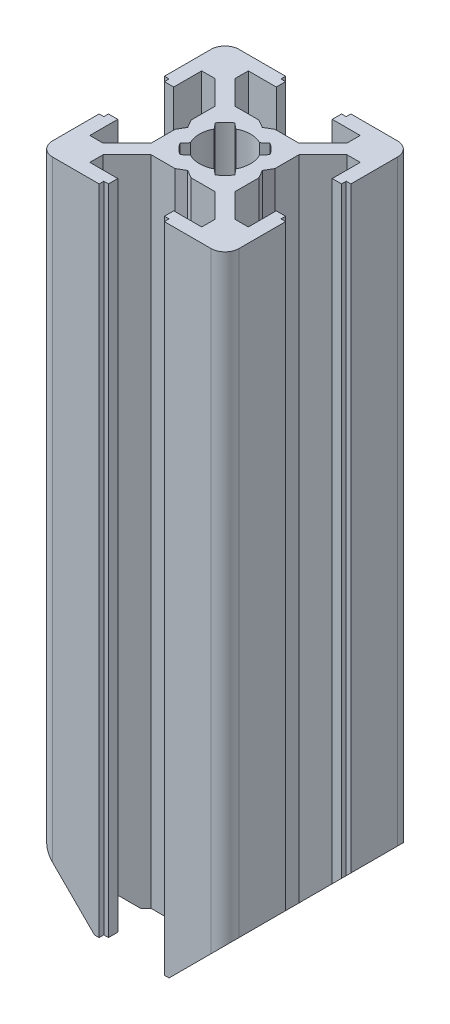
from build123d import *

# Parameters (mm, degrees)
BOSS_EXTRUDE1_DEPTH     = 70
CUT_EXTRUDE1_DEPTH      = 72.414284285
CUT_EXTRUDE1_DEPTH_BACK = 72.414284285
SKETCH3_R               = 2


# Read off the part's stored shape, not the designer's step: Imported1
with BuildPart() as part:
    # Sketch1 → Boss-Extrude1 (new body)
    with BuildSketch(Plane(origin=(0, 0, 0), x_dir=(1, 0, 0), z_dir=(0, 1, 0))):
        with BuildLine():
            Line((4.5, -0.866025), (4, 0))
            Line((4, 0), (4.5, 0.866025))
            Line((4.5, 0.866025), (4.5, 3.43934))
            Line((4.5, 3.43934), (7.06066, 6))
            Line((7.06066, 6), (8.5, 6))
            Line((8.5, 6), (8.5, 3))
            Line((8.5, 3), (9.5, 3))
            Line((9.5, 3), (9.5, 3.5))
            Line((9.5, 3.5), (10, 3.5))
            Line((10, 3.5), (10, 8.5))
            ThreePointArc((10, 8.5), (9.560660172, 9.560660172), (8.5, 10))
            Line((8.5, 10), (3.5, 10))
            Line((3.5, 10), (3.5, 9.5))
            Line((3.5, 9.5), (3, 9.5))
            Line((3, 9.5), (3, 8.5))
            Line((3, 8.5), (6, 8.5))
            Line((6, 8.5), (6, 7.06066))
            Line((6, 7.06066), (3.43934, 4.5))
            Line((3.43934, 4.5), (0.866025, 4.5))
            Line((0.866025, 4.5), (0, 4))
            Line((0, 4), (-0.866025, 4.5))
            Line((-0.866025, 4.5), (-3.43934, 4.5))
            Line((-3.43934, 4.5), (-6, 7.06066))
            Line((-6, 7.06066), (-6, 8.5))
            Line((-6, 8.5), (-3, 8.5))
            Line((-3, 8.5), (-3, 9.5))
            Line((-3, 9.5), (-3.5, 9.5))
            Line((-3.5, 9.5), (-3.5, 10))
            Line((-3.5, 10), (-8.5, 10))
            ThreePointArc((-8.5, 10), (-9.560660172, 9.560660172), (-10, 8.5))
            Line((-10, 8.5), (-10, 3.5))
            Line((-10, 3.5), (-9.5, 3.5))
            Line((-9.5, 3.5), (-9.5, 3))
            Line((-9.5, 3), (-8.5, 3))
            Line((-8.5, 3), (-8.5, 6))
            Line((-8.5, 6), (-7.06066, 6))
            Line((-7.06066, 6), (-4.5, 3.43934))
            Line((-4.5, 3.43934), (-4.5, 0.866025))
            Line((-4.5, 0.866025), (-4, 0))
            Line((-4, 0), (-4.5, -0.866025))
            Line((-4.5, -0.866025), (-4.5, -3.43934))
            Line((-4.5, -3.43934), (-7.06066, -6))
            Line((-7.06066, -6), (-8.5, -6))
            Line((-8.5, -6), (-8.5, -3))
            Line((-8.5, -3), (-9.5, -3))
            Line((-9.5, -3), (-9.5, -3.5))
            Line((-9.5, -3.5), (-10, -3.5))
            Line((-10, -3.5), (-10, -8.5))
            ThreePointArc((-10, -8.5), (-9.560660172, -9.560660172), (-8.5, -10))
            Line((-8.5, -10), (-3.5, -10))
            Line((-3.5, -10), (-3.5, -9.5))
            Line((-3.5, -9.5), (-3, -9.5))
            Line((-3, -9.5), (-3, -8.5))
            Line((-3, -8.5), (-6, -8.5))
            Line((-6, -8.5), (-6, -7.06066))
            Line((-6, -7.06066), (-3.43934, -4.5))
            Line((-3.43934, -4.5), (-0.866025, -4.5))
            Line((-0.866025, -4.5), (0, -4))
            Line((0, -4), (0.866025, -4.5))
            Line((0.866025, -4.5), (3.43934, -4.5))
            Line((3.43934, -4.5), (6, -7.06066))
            Line((6, -7.06066), (6, -8.5))
            Line((6, -8.5), (3, -8.5))
            Line((3, -8.5), (3, -9.5))
            Line((3, -9.5), (3.5, -9.5))
            Line((3.5, -9.5), (3.5, -10))
            Line((3.5, -10), (8.5, -10))
            ThreePointArc((8.5, -10), (9.560660172, -9.560660172), (10, -8.5))
            Line((10, -8.5), (10, -3.5))
            Line((10, -3.5), (9.5, -3.5))
            Line((9.5, -3.5), (9.5, -3))
            Line((9.5, -3), (8.5, -3))
            Line((8.5, -3), (8.5, -6))
            Line((8.5, -6), (7.06066, -6))
            Line((7.06066, -6), (4.5, -3.43934))
            Line((4.5, -3.43934), (4.5, -0.866025))
        make_face()
        with BuildLine():
            Line((2.947757456, -1.8869899), (2.435674593, -1.276711693))
            ThreePointArc((2.435674593, -1.276711693), (2.750000433, -2.31e-07), (2.435674303, 1.276711159))
            Line((2.435674303, 1.276711159), (2.947757255, 1.886989128))
            ThreePointArc((2.947757255, 1.886989128), (2.474929059, 2.474818349), (1.887120795, 2.947672597))
            Line((1.887120795, 2.947672597), (1.276854759, 2.435598541))
            ThreePointArc((1.276854759, 2.435598541), (-1.33e-07, 2.749999412), (-1.276854885, 2.435597973))
            Line((-1.276854885, 2.435597973), (-1.887121068, 2.94767181))
            ThreePointArc((-1.887121068, 2.94767181), (-2.47492916, 2.474817292), (-2.947757123, 1.886987839))
            Line((-2.947757123, 1.886987839), (-2.43567406, 1.276709798))
            ThreePointArc((-2.43567406, 1.276709798), (-2.749999477, -6.08e-07), (-2.435674, -1.276711))
            Line((-2.435674, -1.276711), (-2.947757054, -1.886989034))
            ThreePointArc((-2.947757054, -1.886989034), (-2.474929075, -2.474818464), (-1.887120973, -2.947672958))
            Line((-1.887120973, -2.947672958), (-1.276855, -2.435599))
            ThreePointArc((-1.276855, -2.435599), (-1.15e-07, -2.750000499), (1.276854906, -2.43559955))
            Line((1.276854906, -2.43559955), (1.887120935, -2.947673594))
            ThreePointArc((1.887120935, -2.947673594), (2.47492925, -2.474819245), (2.947757456, -1.8869899))
        make_face(mode=Mode.SUBTRACT)
    extrude(amount=BOSS_EXTRUDE1_DEPTH)

    # Sketch3 → Cut-Extrude1 (cut, two sides: drawn at the far end of the back side and taken through both)
    with BuildSketch(Plane.XY.offset(-CUT_EXTRUDE1_DEPTH_BACK)):
        with Locations(Location((0, 8, 0), (0, 0, 340.658342389))):
            Circle(SKETCH3_R)
        Polygon((-10, 6), (-4, 0), (-10, 0), align=None)
        Polygon((10, 0), (10, 6), (4, 0), align=None)
    extrude(amount=CUT_EXTRUDE1_DEPTH + CUT_EXTRUDE1_DEPTH_BACK, mode=Mode.SUBTRACT)


solid = part.part
